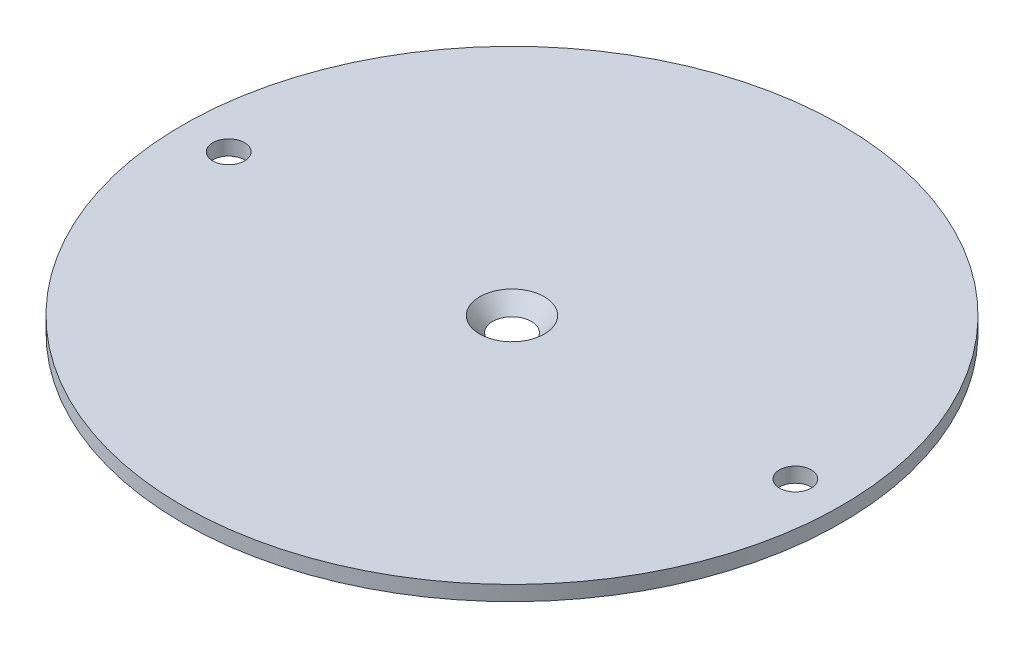
from build123d import *

# Parameters (mm, degrees)
SKETCH2_R               = 70.1675
BOSS_EXTRUDE1_DEPTH     = 3.175
F_1_4_CLEARANCE_HOLE1_D = 6.7564


with BuildPart() as part:
    # Sketch2 → Boss-Extrude1 (new body)
    with BuildSketch(Plane(origin=(0, 0, 0), x_dir=(1, 0, 0), z_dir=(0, 1, 0))):
        Circle(SKETCH2_R)
    extrude(amount=BOSS_EXTRUDE1_DEPTH)

    # 1/4 Clearance Hole1 (through all)
    with Locations(Plane(origin=(0, 3.175, 0), x_dir=(1, 0, 0), z_dir=(0, 1, 0))):
        with Locations((-60.325, 0), (60.325, 0)):
            Hole(F_1_4_CLEARANCE_HOLE1_D / 2)

    # Sketch7 → CSK for 1/4 Flat Head Machine Screw1 (revolve, cut)
    with BuildSketch(Plane(origin=(0, 3.175, 0), x_dir=(0, 0, 1), z_dir=(1, 0, 0))):
        Polygon((0, 0), (0, 3.175), (3.3782, 3.175), (3.3782, 4.032271341), (6.8834, 0), align=None)
    revolve(axis=Axis((0, 9.525, 0), (0, -1, 0)), mode=Mode.SUBTRACT)


solid = part.part
